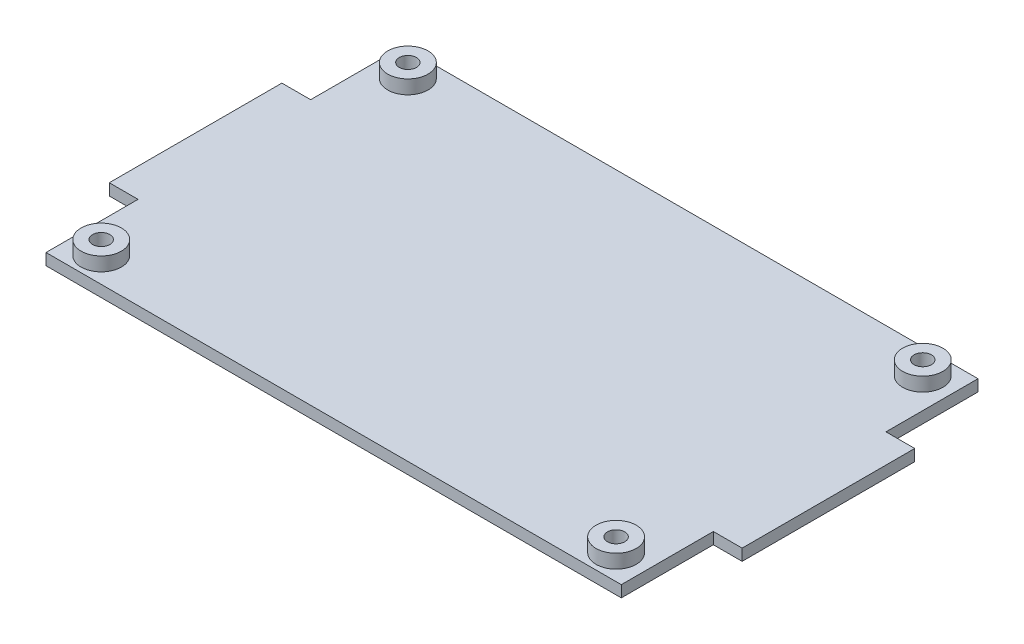
from build123d import *

# Parameters (mm, degrees)
SKETCH_1_W            = 100
SKETCH_1_H            = 62
SKETCH_1_W_2          = 110
SKETCH_1_H_2          = 30
EXTRUDE_471_DEPTH     = 2
SKETCH_2_R            = 1.5
CUT_EXTRUDE_831_DEPTH = 2
EXTRUDE_START         = 2.4
SKETCH_3_R            = 3.5
SKETCH_3_R_2          = 1.5
EXTRUDE_1147_DEPTH    = 2.4


with BuildPart() as part:
    # 草图1 → Extrude 471 (new body)
    with BuildSketch(Plane(origin=(0, 0, 0), x_dir=(1, 0, 0), z_dir=(0, 1, 0))):
        Rectangle(SKETCH_1_W, SKETCH_1_H)
        Rectangle(SKETCH_1_W_2, SKETCH_1_H_2)
    extrude(amount=EXTRUDE_471_DEPTH)

    # 草图2 → Cut-Extrude 831 (cut)
    with BuildSketch(Plane(origin=(0, 2, 0), x_dir=(1, 0, 0), z_dir=(0, 1, 0))):
        with Locations((-44.75, 26.65)):
            Circle(SKETCH_2_R)
        with Locations((44.75, 26.65)):
            Circle(SKETCH_2_R)
        with Locations((-44.75, -26.65)):
            Circle(SKETCH_2_R)
        with Locations((44.75, -26.65)):
            Circle(SKETCH_2_R)
    extrude(amount=-CUT_EXTRUDE_831_DEPTH, mode=Mode.SUBTRACT)

    # 草图3 → Extrude 1147 (add)
    # profile 1 of 4: a face of its own
    with BuildSketch(Plane(origin=(0, 2, 0), x_dir=(1, 0, 0), z_dir=(0, 1, 0)).offset(EXTRUDE_START)):
        with Locations((-44.75, 26.65)):
            Circle(SKETCH_3_R)
        with Locations((-44.75, 26.65)):
            Circle(SKETCH_3_R_2, mode=Mode.SUBTRACT)
    # profile 2 of 4: a face of its own
    with BuildSketch(Plane(origin=(0, 2, 0), x_dir=(1, 0, 0), z_dir=(0, 1, 0)).offset(EXTRUDE_START)):
        with Locations((44.75, 26.65)):
            Circle(SKETCH_3_R)
        with Locations((44.75, 26.65)):
            Circle(SKETCH_3_R_2, mode=Mode.SUBTRACT)
    # profile 3 of 4: a face of its own
    with BuildSketch(Plane(origin=(0, 2, 0), x_dir=(1, 0, 0), z_dir=(0, 1, 0)).offset(EXTRUDE_START)):
        with Locations((-44.75, -26.65)):
            Circle(SKETCH_3_R)
        with Locations((-44.75, -26.65)):
            Circle(SKETCH_3_R_2, mode=Mode.SUBTRACT)
    # profile 4 of 4: a face of its own
    with BuildSketch(Plane(origin=(0, 2, 0), x_dir=(1, 0, 0), z_dir=(0, 1, 0)).offset(EXTRUDE_START)):
        with Locations((44.75, -26.65)):
            Circle(SKETCH_3_R)
        with Locations((44.75, -26.65)):
            Circle(SKETCH_3_R_2, mode=Mode.SUBTRACT)
    extrude(amount=-EXTRUDE_1147_DEPTH)


solid = part.part
